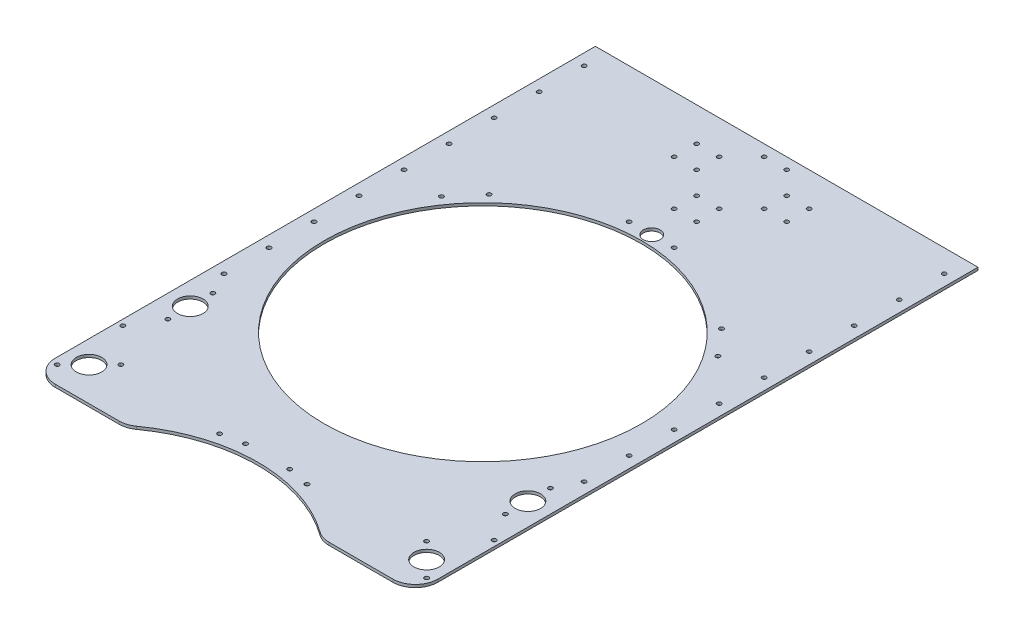
from build123d import *

# Parameters (mm, degrees)
SKETCH1_W           = 431.8
SKETCH1_H           = 685.8
BOSS_EXTRUDE1_DEPTH = 3.175
SKETCH2_R           = 14.3129
SKETCH2_R_2         = 2.38125
CUT_EXTRUDE1_DEPTH  = 406.22006444
SKETCH6_R           = 179.07
CUT_EXTRUDE4_DEPTH  = 406.22006444
SKETCH8_R           = 9.525
SKETCH8_R_2         = 2.38125
CUT_EXTRUDE6_DEPTH  = 406.22006444
FILLET2_R           = 25.4
SKETCH11_R          = 2.38125
CUT_EXTRUDE9_DEPTH  = 406.22006444
SKETCH13_R          = 2.38125
SKETCH13_R_2        = 2.466421692
SKETCH13_R_3        = 2.307769972
CUT_EXTRUDE10_DEPTH = 406.22006444
SKETCH14_R          = 2.38125
CUT_EXTRUDE11_DEPTH = 406.22006444
SKETCH16_W          = 431.8
SKETCH16_H          = 50.8
CUT_EXTRUDE13_DEPTH = 406.22006444
SKETCH17_R          = 177.8
SKETCH17_R_2        = 2.38125
CUT_EXTRUDE14_DEPTH = 406.22006444
FILLET3_R           = 25.4
SKETCH18_R          = 2.38125
CUT_EXTRUDE15_DEPTH = 406.22006444


with BuildPart() as part:
    # Sketch1 → Boss-Extrude1 (new body)
    with BuildSketch(Plane(origin=(0, 0, 0), x_dir=(1, 0, 0), z_dir=(0, 1, 0))):
        Rectangle(SKETCH1_W, SKETCH1_H)
    extrude(amount=BOSS_EXTRUDE1_DEPTH)

    # Sketch2 → Cut-Extrude1 (cut, through all)
    with BuildSketch(Plane(origin=(0, 3.175, 0), x_dir=(1, 0, 0), z_dir=(0, 1, 0))):
        with Locations((-190.5, -304.8)):
            Circle(SKETCH2_R)
        with Locations((-190.5, -190.5)):
            Circle(SKETCH2_R)
        with Locations((190.5, -190.5)):
            Circle(SKETCH2_R)
        with Locations((190.5, -215.9)):
            Circle(SKETCH2_R_2)
        with Locations((190.5, -165.1)):
            Circle(SKETCH2_R_2)
        with Locations((-190.5, -215.9)):
            Circle(SKETCH2_R_2)
        with Locations((-190.5, -165.1)):
            Circle(SKETCH2_R_2)
        with Locations((-208.460512242, -322.760512242)):
            Circle(SKETCH2_R_2)
        with Locations((-172.539487758, -286.839487758)):
            Circle(SKETCH2_R_2)
        with Locations((172.539487758, -286.839487758)):
            Circle(SKETCH2_R_2)
        with Locations((208.460512242, -322.760512242)):
            Circle(SKETCH2_R_2)
        with Locations((190.5, -304.8)):
            Circle(SKETCH2_R)
    extrude(amount=-CUT_EXTRUDE1_DEPTH, mode=Mode.SUBTRACT)

    # Sketch6 → Cut-Extrude4 (cut, through all)
    with BuildSketch(Plane(origin=(0, 3.175, 0), x_dir=(1, 0, 0), z_dir=(0, 1, 0))):
        with Locations((0, -50.8)):
            Circle(SKETCH6_R)
    extrude(amount=-CUT_EXTRUDE4_DEPTH, mode=Mode.SUBTRACT)

    # Sketch8 → Cut-Extrude6 (cut, through all)
    with BuildSketch(Plane(origin=(0, 3.175, 0), x_dir=(1, 0, 0), z_dir=(0, 1, 0))):
        with Locations((0, 139.7)):
            Circle(SKETCH8_R)
        with Locations((25.4, 139.7)):
            Circle(SKETCH8_R_2)
        with Locations((-25.4, 139.7)):
            Circle(SKETCH8_R_2)
    extrude(amount=-CUT_EXTRUDE6_DEPTH, mode=Mode.SUBTRACT)

    # Fillet2
    fillet2_edges = [part.edges().sort_by_distance(p)[0] for p in [
        (215.9, 1.5875, 342.9),
        (-215.9, 1.5875, 342.9),
    ]]
    fillet(fillet2_edges, radius=FILLET2_R)

    # Sketch11 → Cut-Extrude9 (cut, through all)
    with BuildSketch(Plane(origin=(0, 3.175, 0), x_dir=(1, 0, 0), z_dir=(0, 1, 0))):
        with Locations((156.048464437, 58.466311125)):
            Circle(SKETCH11_R)
        with Locations((131.183773775, 87.334237241)):
            Circle(SKETCH11_R)
        with Locations((-131.183773775, 87.334237241)):
            Circle(SKETCH11_R)
        with Locations((-156.048464437, 58.466311125)):
            Circle(SKETCH11_R)
    extrude(amount=-CUT_EXTRUDE9_DEPTH, mode=Mode.SUBTRACT)

    # Sketch13 → Cut-Extrude10 (cut, through all)
    with BuildSketch(Plane(origin=(0, 3.175, 0), x_dir=(1, 0, 0), z_dir=(0, 1, 0))):
        with Locations((-203.2, 317.5)):
            Circle(SKETCH13_R)
        with Locations((-203.2, 266.7)):
            Circle(SKETCH13_R)
        with Locations((-203.2, 215.9)):
            Circle(SKETCH13_R)
        with Locations((-203.2, 165.1)):
            Circle(SKETCH13_R)
        with Locations((-203.2, 114.3)):
            Circle(SKETCH13_R)
        with Locations((-203.2, 63.5)):
            Circle(SKETCH13_R)
        with Locations((-203.2, 12.7)):
            Circle(SKETCH13_R)
        with Locations((-203.2, -38.1)):
            Circle(SKETCH13_R)
        with Locations((-203.2, -88.9)):
            Circle(SKETCH13_R)
        with Locations((-203.2, -139.7)):
            Circle(SKETCH13_R)
        with Locations((203.2, -139.7)):
            Circle(SKETCH13_R)
        with Locations((203.2, 12.7)):
            Circle(SKETCH13_R)
        with Locations((203.2, 63.5)):
            Circle(SKETCH13_R)
        with Locations((203.2, 114.3)):
            Circle(SKETCH13_R)
        with Locations((203.2, 165.1)):
            Circle(SKETCH13_R)
        with Locations((203.2, 266.7)):
            Circle(SKETCH13_R)
        with Locations((203.2, 317.5)):
            Circle(SKETCH13_R)
        with Locations((-25.4, -330.2)):
            Circle(SKETCH13_R_2)
        with Locations((-50.8, -330.2)):
            Circle(SKETCH13_R_3)
        with Locations((50.8, -330.2)):
            Circle(SKETCH13_R_3)
        with Locations((25.4, -330.2)):
            Circle(SKETCH13_R_2)
        with Locations((203.2, -88.9)):
            Circle(SKETCH13_R)
        with Locations((203.2, -38.1)):
            Circle(SKETCH13_R)
        with Locations((203.2, 215.9)):
            Circle(SKETCH13_R)
    extrude(amount=-CUT_EXTRUDE10_DEPTH, mode=Mode.SUBTRACT)

    # Sketch14 → Cut-Extrude11 (cut, through all)
    with BuildSketch(Plane(origin=(0, 3.175, 0), x_dir=(1, 0, 0), z_dir=(0, 1, 0))):
        with Locations((209.55, -247.65)):
            Circle(SKETCH14_R)
        with Locations((-209.55, -247.65)):
            Circle(SKETCH14_R)
    extrude(amount=-CUT_EXTRUDE11_DEPTH, mode=Mode.SUBTRACT)

    # Sketch16 → Cut-Extrude13 (cut, through all)
    with BuildSketch(Plane(origin=(0, 3.175, 0), x_dir=(1, 0, 0), z_dir=(0, 1, 0))):
        with Locations((0, 317.5)):
            Rectangle(SKETCH16_W, SKETCH16_H)
    extrude(amount=-CUT_EXTRUDE13_DEPTH, mode=Mode.SUBTRACT)

    # Sketch17 → Cut-Extrude14 (cut, through all)
    with BuildSketch(Plane(origin=(0, 0, 0), x_dir=(-1, 0, 0), z_dir=(0, -1, 0))):
        with Locations((0, -482.6)):
            Circle(SKETCH17_R)
        with Locations((24.865239618, -293.729753908)):
            Circle(SKETCH17_R_2)
        with Locations((49.305028092, -298.591130092)):
            Circle(SKETCH17_R_2)
        with Locations((-24.865239618, -293.729753908)):
            Circle(SKETCH17_R_2)
        with Locations((-49.305028092, -298.591130092)):
            Circle(SKETCH17_R_2)
    extrude(amount=-CUT_EXTRUDE14_DEPTH, mode=Mode.SUBTRACT)

    # Fillet3
    fillet3_edges = [part.edges().sort_by_distance(p)[0] for p in [
        (109.985226281, 1.5875, 342.9),
        (-109.985226281, 1.5875, 342.9),
    ]]
    fillet(fillet3_edges, radius=FILLET3_R)

    # Sketch18 → Cut-Extrude15 (cut, through all)
    with BuildSketch(Plane(origin=(0, 3.175, 0), x_dir=(1, 0, 0), z_dir=(0, 1, 0))):
        with Locations((38.1, 228.6)):
            Circle(SKETCH18_R)
        with Locations((63.5, 228.6)):
            Circle(SKETCH18_R)
        with Locations((63.5, 254)):
            Circle(SKETCH18_R)
        with Locations((38.1, 254)):
            Circle(SKETCH18_R)
        with Locations((-12.7, 177.8)):
            Circle(SKETCH18_R)
        with Locations((-12.7, 203.2)):
            Circle(SKETCH18_R)
        with Locations((12.7, 177.8)):
            Circle(SKETCH18_R)
        with Locations((12.7, 203.2)):
            Circle(SKETCH18_R)
        with Locations((-63.5, 254)):
            Circle(SKETCH18_R)
        with Locations((-38.1, 254)):
            Circle(SKETCH18_R)
        with Locations((-63.5, 228.6)):
            Circle(SKETCH18_R)
        with Locations((-38.1, 228.6)):
            Circle(SKETCH18_R)
        with Locations((12.7, 304.8)):
            Circle(SKETCH18_R)
        with Locations((12.7, 279.4)):
            Circle(SKETCH18_R)
        with Locations((-12.7, 304.8)):
            Circle(SKETCH18_R)
        with Locations((-12.7, 279.4)):
            Circle(SKETCH18_R)
    extrude(amount=-CUT_EXTRUDE15_DEPTH, mode=Mode.SUBTRACT)


solid = part.part
